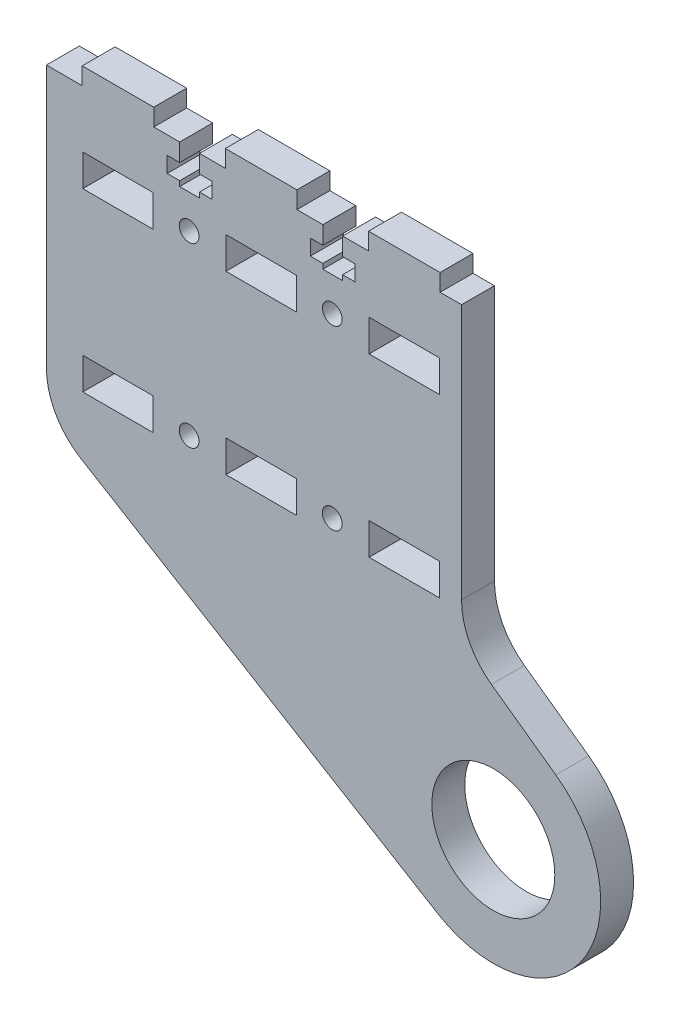
from build123d import *

# Parameters (mm, degrees)
SKETCH1_R           = 10.9125
SKETCH1_W           = 12.5
SKETCH1_H           = 5.642
SKETCH1_R_2         = 1.7526
BOSS_EXTRUDE1_DEPTH = 5.842
FILLET10_R          = 12.7
FILLET11_R          = 12.7
CUT_EXTRUDE9_DEPTH  = 93.478414179
FILLET12_R          = 12.7


with BuildPart() as part:
    # Sketch1 → Boss-Extrude1 (new body)
    with BuildSketch(Plane.XY):
        with BuildLine():
            Line((38.179644021, -25.146), (38.179644021, -12.853632574))
            Line((38.179644021, -12.853632574), (38.179644021, 12.853632574))
            Line((38.179644021, 12.853632574), (38.179644021, 28.575))
            Line((38.179644021, 28.575), (31.829653458, 28.575))
            Line((31.829653458, 28.575), (31.829653458, 31.623))
            Line((31.829653458, 31.623), (19.129653458, 31.623))
            Line((19.129653458, 31.623), (19.129653458, 28.575))
            Line((19.129653458, 28.575), (14.532253458, 28.575))
            Line((14.532253458, 28.575), (14.532253458, 25.4))
            Line((14.532253458, 25.4), (16.748403458, 25.4))
            Line((16.748403458, 25.4), (16.748403458, 22.621875))
            Line((16.748403458, 22.621875), (14.532253458, 22.621875))
            Line((14.532253458, 22.621875), (14.532253458, 21.717))
            Line((14.532253458, 21.717), (11.027053458, 21.717))
            Line((11.027053458, 21.717), (11.027053458, 22.621875))
            Line((11.027053458, 22.621875), (8.810903458, 22.621875))
            Line((8.810903458, 22.621875), (8.810903458, 25.4))
            Line((8.810903458, 25.4), (11.027053458, 25.4))
            Line((11.027053458, 25.4), (11.027053458, 28.575))
            Line((11.027053458, 28.575), (6.429653458, 28.575))
            Line((6.429653458, 28.575), (6.429653458, 31.623))
            Line((6.429653458, 31.623), (-6.270346542, 31.623))
            Line((-6.270346542, 31.623), (-6.270346542, 28.575))
            Line((-6.270346542, 28.575), (-10.867746542, 28.575))
            Line((-10.867746542, 28.575), (-10.867746542, 25.4))
            Line((-10.867746542, 25.4), (-8.651596542, 25.4))
            Line((-8.651596542, 25.4), (-8.651596542, 22.621875))
            Line((-8.651596542, 22.621875), (-10.867746542, 22.621875))
            Line((-10.867746542, 22.621875), (-10.867746542, 21.717))
            Line((-10.867746542, 21.717), (-14.372946542, 21.717))
            Line((-14.372946542, 21.717), (-14.372946542, 22.621875))
            Line((-14.372946542, 22.621875), (-16.589096542, 22.621875))
            Line((-16.589096542, 22.621875), (-16.589096542, 25.4))
            Line((-16.589096542, 25.4), (-14.372946542, 25.4))
            Line((-14.372946542, 25.4), (-14.372946542, 28.575))
            Line((-14.372946542, 28.575), (-18.970346542, 28.575))
            Line((-18.970346542, 28.575), (-18.970346542, 31.623))
            Line((-18.970346542, 31.623), (-31.670346542, 31.623))
            Line((-31.670346542, 31.623), (-31.670346542, 28.575))
            Line((-31.670346542, 28.575), (-38.020337105, 28.575))
            Line((-38.020337105, 28.575), (-38.020337105, 12.8))
            Line((-38.020337105, 12.8), (-38.020337105, -12.8))
            Line((-38.020337105, -12.8), (-38.020337105, -25.146))
            Line((-38.020337105, -25.146), (31.42338471, -67.104851308))
            ThreePointArc((31.42338471, -67.104851308), (57.182029389, -61.281837436), (52.371016552, -35.315139114))
            Line((52.371016552, -35.315139114), (38.179644021, -25.146))
        make_face()
        with Locations((41.275, -50.8)):
            Circle(SKETCH1_R, mode=Mode.SUBTRACT)
        with Locations((-25.320337105, -15.621)):
            Rectangle(SKETCH1_W, SKETCH1_H, mode=Mode.SUBTRACT)
        with Locations((-12.7, -15.721)):
            Circle(SKETCH1_R_2, mode=Mode.SUBTRACT)
        with Locations((0.079662895, -15.621)):
            Rectangle(SKETCH1_W, SKETCH1_H, mode=Mode.SUBTRACT)
        with Locations((-25.320337105, 15.621)):
            Rectangle(SKETCH1_W, SKETCH1_H, mode=Mode.SUBTRACT)
        with Locations((-12.7, 15.721)):
            Circle(SKETCH1_R_2, mode=Mode.SUBTRACT)
        with Locations((0.079662895, 15.621)):
            Rectangle(SKETCH1_W, SKETCH1_H, mode=Mode.SUBTRACT)
        with Locations((12.7, -15.721)):
            Circle(SKETCH1_R_2, mode=Mode.SUBTRACT)
        with Locations((25.479662895, -15.621)):
            Rectangle(SKETCH1_W, SKETCH1_H, mode=Mode.SUBTRACT)
        with Locations((12.7, 15.721)):
            Circle(SKETCH1_R_2, mode=Mode.SUBTRACT)
        with Locations((25.479662895, 15.621)):
            Rectangle(SKETCH1_W, SKETCH1_H, mode=Mode.SUBTRACT)
    extrude(amount=BOSS_EXTRUDE1_DEPTH)

    # Fillet10
    fillet10_edges = [part.edges().sort_by_distance(p)[0] for p in [
        (-38.020337105, -25.146, 2.921),
    ]]
    fillet(fillet10_edges, radius=FILLET10_R)

    # Fillet11
    fillet11_edges = [part.edges().sort_by_distance(p)[0] for p in [
        (38.179644021, -25.146, 2.921),
    ]]
    fillet(fillet11_edges, radius=FILLET11_R)

    # Sketch16 → Cut-Extrude9 (cut, through all)
    with BuildSketch(Plane(origin=(0, 0, 0), x_dir=(-1, 0, 0), z_dir=(0, 0, -1))):
        with BuildLine():
            Line((-35.639644021, 28.575), (-35.639644021, -23.325907314))
            Line((-35.639644021, -23.325907314), (-43.482299653, -28.945734146))
            ThreePointArc((-43.482299653, -28.945734146), (-39.582824259, -24.425239738), (-38.179644021, -18.622493555))
            Line((-38.179644021, -18.622493555), (-38.179644021, 28.575))
            Line((-38.179644021, 28.575), (-35.639644021, 28.575))
        make_face()
    extrude(amount=-CUT_EXTRUDE9_DEPTH, mode=Mode.SUBTRACT)

    # Fillet12
    fillet12_edges = [part.edges().sort_by_distance(p)[0] for p in [
        (35.639644021, -23.325907314, 2.921),
    ]]
    fillet(fillet12_edges, radius=FILLET12_R)


solid = part.part
